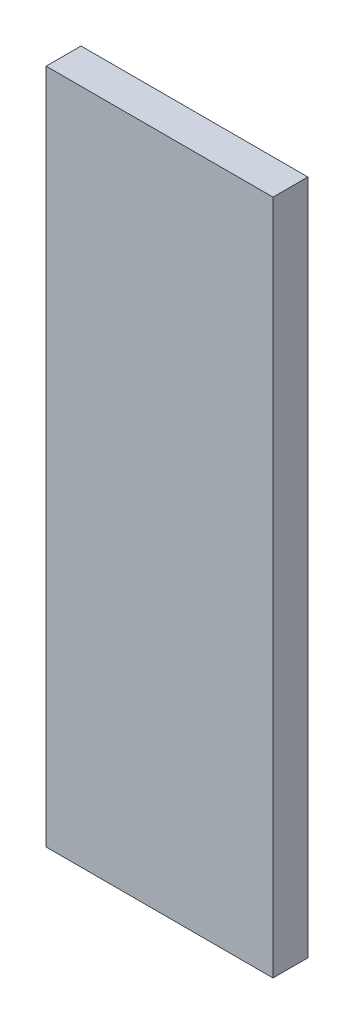
from build123d import *

# Parameters (mm, degrees)
SKETCH1_W           = 26
SKETCH1_H           = 4
BOSS_EXTRUDE1_DEPTH = 77.5


with BuildPart() as part:
    # Sketch1 → Boss-Extrude1 (new body)
    with BuildSketch(Plane(origin=(0, 0, 0), x_dir=(1, 0, 0), z_dir=(0, 1, 0))):
        Rectangle(SKETCH1_W, SKETCH1_H)
    extrude(amount=BOSS_EXTRUDE1_DEPTH)


solid = part.part
